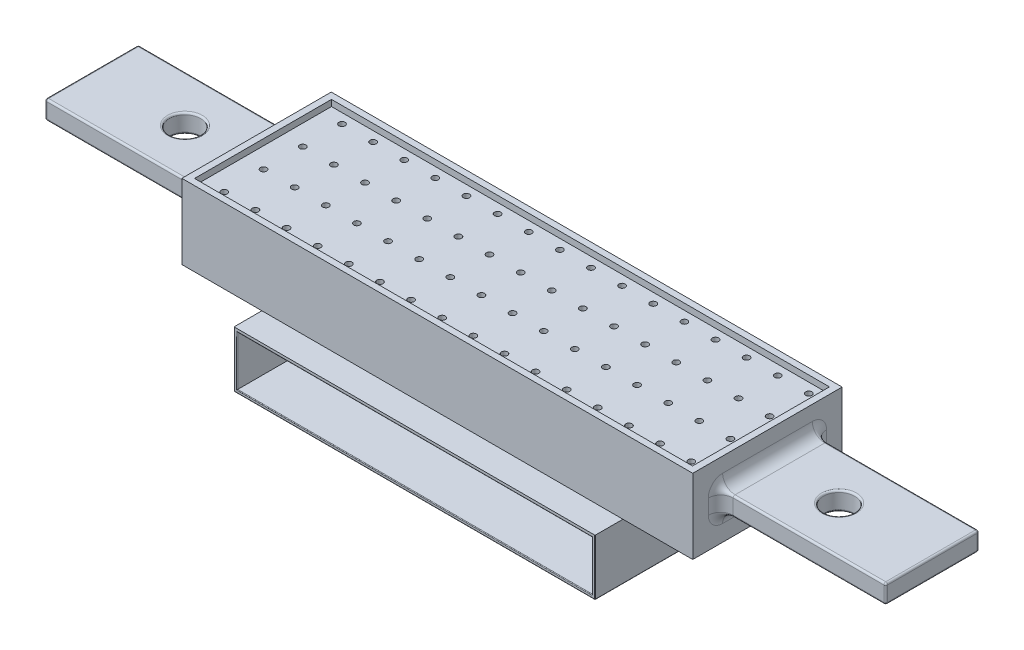
from build123d import *

# Parameters (mm, degrees)
SKETCH1_W           = 80
SKETCH1_H           = 22
SKETCH1_R           = 0.5
BOSS_EXTRUDE1_DEPTH = 10
BOSS_EXTRUDE2_START = -1
SKETCH6_W           = 82
SKETCH6_H           = 24
SKETCH6_W_2         = 80
SKETCH6_H_2         = 22
BOSS_EXTRUDE2_DEPTH = 12
SKETCH7_W           = 15
SKETCH7_H           = 3
BOSS_EXTRUDE3_DEPTH = 26.5
SKETCH8_R           = 2.5
CUT_EXTRUDE1_DEPTH  = 111.232726826
FILLET1_R           = 0.3
SKETCH10_W          = 58
SKETCH10_H          = 32
BOSS_EXTRUDE4_DEPTH = 9
SHELL1_START        = 0.5
SHELL1_OUTLINE_W    = 81.075214662
SHELL1_OUTLINE_H    = 23
SHELL1_OUTLINE_R    = 1
SHELL1_DEPTH        = 9
SHELL1_START_2      = -9.5
SHELL1_2_OUTLINE_W  = 57
SHELL1_2_OUTLINE_H  = 31.5
SHELL1_2_DEPTH      = 8
SHELL1_START_3      = 4.110326736
SHELL1_3_OUTLINE_W  = 26.5
SHELL1_3_OUTLINE_H  = 14
SHELL1_3_OUTLINE_R  = 3
SHELL1_3_DEPTH      = 2
SHELL1_START_4      = -0.5
SHELL1_4_OUTLINE_W  = 0.037607331
SHELL1_4_OUTLINE_H  = 23
SHELL1_4_DEPTH      = 11
FILLET2_R           = 0.1
FILLET3_R           = 2


# Read off the part's stored shape, not the designer's step: Shell1
with BuildPart() as part:
    # Sketch1 → Boss-Extrude1 (new body)
    with BuildSketch(Plane(origin=(0, 0, 0), x_dir=(1, 0, 0), z_dir=(0, 1, 0))):
        with Locations((40, 11)):
            Rectangle(SKETCH1_W, SKETCH1_H)
        with Locations(Location((78.276716264, 1.510550974, 0), (0, 0, 270))):
            Circle(SKETCH1_R, mode=Mode.SUBTRACT)
        with Locations(Location((73.276716264, 1.510550974, 0), (0, 0, 270))):
            Circle(SKETCH1_R, mode=Mode.SUBTRACT)
        with Locations(Location((68.276716264, 1.510550974, 0), (0, 0, 270))):
            Circle(SKETCH1_R, mode=Mode.SUBTRACT)
        with Locations(Location((63.276716264, 1.510550974, 0), (0, 0, 270))):
            Circle(SKETCH1_R, mode=Mode.SUBTRACT)
        with Locations(Location((58.276716264, 1.510550974, 0), (0, 0, 270))):
            Circle(SKETCH1_R, mode=Mode.SUBTRACT)
        with Locations(Location((53.276716264, 1.510550974, 0), (0, 0, 270))):
            Circle(SKETCH1_R, mode=Mode.SUBTRACT)
        with Locations(Location((48.276716264, 1.510550974, 0), (0, 0, 270))):
            Circle(SKETCH1_R, mode=Mode.SUBTRACT)
        with Locations(Location((43.276716264, 1.510550974, 0), (0, 0, 270))):
            Circle(SKETCH1_R, mode=Mode.SUBTRACT)
        with Locations(Location((38.276716264, 1.510550974, 0), (0, 0, 270))):
            Circle(SKETCH1_R, mode=Mode.SUBTRACT)
        with Locations(Location((33.276716264, 1.510550974, 0), (0, 0, 270))):
            Circle(SKETCH1_R, mode=Mode.SUBTRACT)
        with Locations(Location((28.276716264, 1.510550974, 0), (0, 0, 270))):
            Circle(SKETCH1_R, mode=Mode.SUBTRACT)
        with Locations(Location((23.276716264, 1.510550974, 0), (0, 0, 270))):
            Circle(SKETCH1_R, mode=Mode.SUBTRACT)
        with Locations(Location((18.276716264, 1.510550974, 0), (0, 0, 270))):
            Circle(SKETCH1_R, mode=Mode.SUBTRACT)
        with Locations(Location((13.276716264, 1.510550974, 0), (0, 0, 270))):
            Circle(SKETCH1_R, mode=Mode.SUBTRACT)
        with Locations(Location((8.276716264, 1.510550974, 0), (0, 0, 270))):
            Circle(SKETCH1_R, mode=Mode.SUBTRACT)
        with Locations(Location((3.276716264, 1.510550974, 0), (0, 0, 270))):
            Circle(SKETCH1_R, mode=Mode.SUBTRACT)
        with Locations(Location((73.276716264, 7.810550974, 0), (0, 0, 270))):
            Circle(SKETCH1_R, mode=Mode.SUBTRACT)
        with Locations(Location((68.276716264, 7.810550974, 0), (0, 0, 270))):
            Circle(SKETCH1_R, mode=Mode.SUBTRACT)
        with Locations(Location((63.276716264, 7.810550974, 0), (0, 0, 270))):
            Circle(SKETCH1_R, mode=Mode.SUBTRACT)
        with Locations(Location((58.276716264, 7.810550974, 0), (0, 0, 270))):
            Circle(SKETCH1_R, mode=Mode.SUBTRACT)
        with Locations(Location((53.276716264, 7.810550974, 0), (0, 0, 270))):
            Circle(SKETCH1_R, mode=Mode.SUBTRACT)
        with Locations(Location((48.276716264, 7.810550974, 0), (0, 0, 270))):
            Circle(SKETCH1_R, mode=Mode.SUBTRACT)
        with Locations(Location((43.276716264, 7.810550974, 0), (0, 0, 270))):
            Circle(SKETCH1_R, mode=Mode.SUBTRACT)
        with Locations(Location((38.276716264, 7.810550974, 0), (0, 0, 270))):
            Circle(SKETCH1_R, mode=Mode.SUBTRACT)
        with Locations(Location((33.276716264, 7.810550974, 0), (0, 0, 270))):
            Circle(SKETCH1_R, mode=Mode.SUBTRACT)
        with Locations(Location((28.276716264, 7.810550974, 0), (0, 0, 270))):
            Circle(SKETCH1_R, mode=Mode.SUBTRACT)
        with Locations(Location((23.276716264, 7.810550974, 0), (0, 0, 270))):
            Circle(SKETCH1_R, mode=Mode.SUBTRACT)
        with Locations(Location((18.276716264, 7.810550974, 0), (0, 0, 270))):
            Circle(SKETCH1_R, mode=Mode.SUBTRACT)
        with Locations(Location((13.276716264, 7.810550974, 0), (0, 0, 270))):
            Circle(SKETCH1_R, mode=Mode.SUBTRACT)
        with Locations(Location((8.276716264, 7.810550974, 0), (0, 0, 270))):
            Circle(SKETCH1_R, mode=Mode.SUBTRACT)
        with Locations(Location((3.276716264, 7.810550974, 0), (0, 0, 270))):
            Circle(SKETCH1_R, mode=Mode.SUBTRACT)
        with Locations(Location((73.276716264, 14.110550974, 0), (0, 0, 270))):
            Circle(SKETCH1_R, mode=Mode.SUBTRACT)
        with Locations(Location((68.276716264, 14.110550974, 0), (0, 0, 270))):
            Circle(SKETCH1_R, mode=Mode.SUBTRACT)
        with Locations(Location((63.276716264, 14.110550974, 0), (0, 0, 270))):
            Circle(SKETCH1_R, mode=Mode.SUBTRACT)
        with Locations(Location((58.276716264, 14.110550974, 0), (0, 0, 270))):
            Circle(SKETCH1_R, mode=Mode.SUBTRACT)
        with Locations(Location((53.276716264, 14.110550974, 0), (0, 0, 270))):
            Circle(SKETCH1_R, mode=Mode.SUBTRACT)
        with Locations(Location((48.276716264, 14.110550974, 0), (0, 0, 270))):
            Circle(SKETCH1_R, mode=Mode.SUBTRACT)
        with Locations(Location((43.276716264, 14.110550974, 0), (0, 0, 270))):
            Circle(SKETCH1_R, mode=Mode.SUBTRACT)
        with Locations(Location((38.276716264, 14.110550974, 0), (0, 0, 270))):
            Circle(SKETCH1_R, mode=Mode.SUBTRACT)
        with Locations(Location((33.276716264, 14.110550974, 0), (0, 0, 270))):
            Circle(SKETCH1_R, mode=Mode.SUBTRACT)
        with Locations(Location((28.276716264, 14.110550974, 0), (0, 0, 270))):
            Circle(SKETCH1_R, mode=Mode.SUBTRACT)
        with Locations(Location((23.276716264, 14.110550974, 0), (0, 0, 270))):
            Circle(SKETCH1_R, mode=Mode.SUBTRACT)
        with Locations(Location((18.276716264, 14.110550974, 0), (0, 0, 270))):
            Circle(SKETCH1_R, mode=Mode.SUBTRACT)
        with Locations(Location((13.276716264, 14.110550974, 0), (0, 0, 270))):
            Circle(SKETCH1_R, mode=Mode.SUBTRACT)
        with Locations(Location((8.276716264, 14.110550974, 0), (0, 0, 270))):
            Circle(SKETCH1_R, mode=Mode.SUBTRACT)
        with Locations(Location((3.276716264, 14.110550974, 0), (0, 0, 270))):
            Circle(SKETCH1_R, mode=Mode.SUBTRACT)
        with Locations(Location((73.276716264, 20.410550974, 0), (0, 0, 270))):
            Circle(SKETCH1_R, mode=Mode.SUBTRACT)
        with Locations(Location((68.276716264, 20.410550974, 0), (0, 0, 270))):
            Circle(SKETCH1_R, mode=Mode.SUBTRACT)
        with Locations(Location((63.276716264, 20.410550974, 0), (0, 0, 270))):
            Circle(SKETCH1_R, mode=Mode.SUBTRACT)
        with Locations(Location((58.276716264, 20.410550974, 0), (0, 0, 270))):
            Circle(SKETCH1_R, mode=Mode.SUBTRACT)
        with Locations(Location((53.276716264, 20.410550974, 0), (0, 0, 270))):
            Circle(SKETCH1_R, mode=Mode.SUBTRACT)
        with Locations(Location((48.276716264, 20.410550974, 0), (0, 0, 270))):
            Circle(SKETCH1_R, mode=Mode.SUBTRACT)
        with Locations(Location((43.276716264, 20.410550974, 0), (0, 0, 270))):
            Circle(SKETCH1_R, mode=Mode.SUBTRACT)
        with Locations(Location((38.276716264, 20.410550974, 0), (0, 0, 270))):
            Circle(SKETCH1_R, mode=Mode.SUBTRACT)
        with Locations(Location((33.276716264, 20.410550974, 0), (0, 0, 270))):
            Circle(SKETCH1_R, mode=Mode.SUBTRACT)
        with Locations(Location((28.276716264, 20.410550974, 0), (0, 0, 270))):
            Circle(SKETCH1_R, mode=Mode.SUBTRACT)
        with Locations(Location((23.276716264, 20.410550974, 0), (0, 0, 270))):
            Circle(SKETCH1_R, mode=Mode.SUBTRACT)
        with Locations(Location((18.276716264, 20.410550974, 0), (0, 0, 270))):
            Circle(SKETCH1_R, mode=Mode.SUBTRACT)
        with Locations(Location((13.276716264, 20.410550974, 0), (0, 0, 270))):
            Circle(SKETCH1_R, mode=Mode.SUBTRACT)
        with Locations(Location((8.276716264, 20.410550974, 0), (0, 0, 270))):
            Circle(SKETCH1_R, mode=Mode.SUBTRACT)
        with Locations(Location((3.276716264, 20.410550974, 0), (0, 0, 270))):
            Circle(SKETCH1_R, mode=Mode.SUBTRACT)
        with Locations(Location((78.276716264, 7.810550974, 0), (0, 0, 270))):
            Circle(SKETCH1_R, mode=Mode.SUBTRACT)
        with Locations(Location((78.276716264, 14.110550974, 0), (0, 0, 270))):
            Circle(SKETCH1_R, mode=Mode.SUBTRACT)
        with Locations(Location((78.276716264, 20.410550974, 0), (0, 0, 270))):
            Circle(SKETCH1_R, mode=Mode.SUBTRACT)
    extrude(amount=BOSS_EXTRUDE1_DEPTH)

    # Sketch6 → Boss-Extrude2 (add)
    with BuildSketch(Plane(origin=(0, 0, 0), x_dir=(1, 0, 0), z_dir=(0, 1, 0)).offset(BOSS_EXTRUDE2_START)):
        with Locations((39.962392669, 11)):
            Rectangle(SKETCH6_W, SKETCH6_H)
        with Locations((40, 11)):
            Rectangle(SKETCH6_W_2, SKETCH6_H_2, mode=Mode.SUBTRACT)
    boss_extrude2 = extrude(amount=BOSS_EXTRUDE2_DEPTH)

    # Sketch7 → Boss-Extrude3 (add)
    with BuildSketch(Plane.ZY.offset(1.037607331)):
        with Locations((-11, 5.110326736)):
            Rectangle(SKETCH7_W, SKETCH7_H)
    boss_extrude3 = extrude(amount=BOSS_EXTRUDE3_DEPTH)

    # Mirror2: Boss-Extrude2, Boss-Extrude3 across plane
    add(boss_extrude2.mirror(Plane(origin=(40, 0, 0), x_dir=(0, 0, 1), z_dir=(1, 0, 0))))
    add(boss_extrude3.mirror(Plane(origin=(40, 0, 0), x_dir=(0, 0, 1), z_dir=(1, 0, 0))))

    # Sketch8 → Cut-Extrude1 (cut, through all)
    with BuildSketch(Plane(origin=(0, 6.610326736, 0), x_dir=(1, 0, 0), z_dir=(0, 1, 0))):
        with Locations(Location((-12.537607331, 11, 0), (0, 0, 270))):
            Circle(SKETCH8_R)
    cut_extrude1 = extrude(amount=-CUT_EXTRUDE1_DEPTH, mode=Mode.SUBTRACT)

    # Mirror3: Cut-Extrude1 across plane
    add(cut_extrude1.mirror(Plane(origin=(40, 0, 0), x_dir=(0, 0, 1), z_dir=(1, 0, 0))), mode=Mode.SUBTRACT)

    # Fillet1
    fillet1_edges = [part.edges().sort_by_distance(p)[0] for p in [
        (-14.287607331, 3.610326736, -3.5),
        (-14.287607331, 6.610326736, -3.5),
        (-14.287607331, 6.610326736, -18.5),
        (-14.287607331, 3.610326736, -18.5),
        (-27.537607331, 5.110326736, -3.5),
        (-27.537607331, 6.610326736, -11),
        (-27.537607331, 5.110326736, -18.5),
        (-27.537607331, 3.610326736, -11),
        (107.537607331, 5.110326736, -3.5),
        (94.287607331, 6.610326736, -3.5),
        (107.537607331, 3.610326736, -11),
        (94.287607331, 3.610326736, -3.5),
        (107.537607331, 5.110326736, -18.5),
        (94.287607331, 3.610326736, -18.5),
        (107.537607331, 6.610326736, -11),
        (94.287607331, 6.610326736, -18.5),
        (-12.537607331, 3.610326736, -13.5),
        (-12.537607331, 6.610326736, -13.5),
        (92.537607331, 3.610326736, -13.5),
        (92.537607331, 6.610326736, -13.5),
    ]]
    fillet(fillet1_edges, radius=FILLET1_R)

    # Sketch10 → Boss-Extrude4 (add)
    with BuildSketch(Plane(origin=(0, -1, 0), x_dir=(1, 0, 0), z_dir=(0, 1, 0))):
        with Locations((40.819120301, 10.527322686)):
            Rectangle(SKETCH10_W, SKETCH10_H)
    extrude(amount=-BOSS_EXTRUDE4_DEPTH)

    # Shell1 outline → Shell1 (cut)
    with BuildSketch(Plane(origin=(0, 0, 0), x_dir=(1, 0, 0), z_dir=(0, 1, 0)).offset(SHELL1_START)):
        with Locations((40, 11)):
            Rectangle(SHELL1_OUTLINE_W, SHELL1_OUTLINE_H)
        with Locations((13.276716264, 1.510550974)):
            Circle(SHELL1_OUTLINE_R, mode=Mode.SUBTRACT)
        with Locations((13.276716264, 7.810550974)):
            Circle(SHELL1_OUTLINE_R, mode=Mode.SUBTRACT)
        with Locations((13.276716264, 14.110550974)):
            Circle(SHELL1_OUTLINE_R, mode=Mode.SUBTRACT)
        with Locations((13.276716264, 20.410550974)):
            Circle(SHELL1_OUTLINE_R, mode=Mode.SUBTRACT)
        with Locations((18.276716264, 1.510550974)):
            Circle(SHELL1_OUTLINE_R, mode=Mode.SUBTRACT)
        with Locations((23.276716264, 1.510550974)):
            Circle(SHELL1_OUTLINE_R, mode=Mode.SUBTRACT)
        with Locations((28.276716264, 1.510550974)):
            Circle(SHELL1_OUTLINE_R, mode=Mode.SUBTRACT)
        with Locations((33.276716264, 1.510550974)):
            Circle(SHELL1_OUTLINE_R, mode=Mode.SUBTRACT)
        with Locations((38.276716264, 1.510550974)):
            Circle(SHELL1_OUTLINE_R, mode=Mode.SUBTRACT)
        with Locations((18.276716264, 7.810550974)):
            Circle(SHELL1_OUTLINE_R, mode=Mode.SUBTRACT)
        with Locations((23.276716264, 7.810550974)):
            Circle(SHELL1_OUTLINE_R, mode=Mode.SUBTRACT)
        with Locations((28.276716264, 7.810550974)):
            Circle(SHELL1_OUTLINE_R, mode=Mode.SUBTRACT)
        with Locations((33.276716264, 7.810550974)):
            Circle(SHELL1_OUTLINE_R, mode=Mode.SUBTRACT)
        with Locations((38.276716264, 7.810550974)):
            Circle(SHELL1_OUTLINE_R, mode=Mode.SUBTRACT)
        with Locations((43.276716264, 1.510550974)):
            Circle(SHELL1_OUTLINE_R, mode=Mode.SUBTRACT)
        with Locations((48.276716264, 1.510550974)):
            Circle(SHELL1_OUTLINE_R, mode=Mode.SUBTRACT)
        with Locations((53.276716264, 1.510550974)):
            Circle(SHELL1_OUTLINE_R, mode=Mode.SUBTRACT)
        with Locations((58.276716264, 1.510550974)):
            Circle(SHELL1_OUTLINE_R, mode=Mode.SUBTRACT)
        with Locations((63.276716264, 1.510550974)):
            Circle(SHELL1_OUTLINE_R, mode=Mode.SUBTRACT)
        with Locations((68.276716264, 1.510550974)):
            Circle(SHELL1_OUTLINE_R, mode=Mode.SUBTRACT)
        with Locations((43.276716264, 7.810550974)):
            Circle(SHELL1_OUTLINE_R, mode=Mode.SUBTRACT)
        with Locations((48.276716264, 7.810550974)):
            Circle(SHELL1_OUTLINE_R, mode=Mode.SUBTRACT)
        with Locations((53.276716264, 7.810550974)):
            Circle(SHELL1_OUTLINE_R, mode=Mode.SUBTRACT)
        with Locations((58.276716264, 7.810550974)):
            Circle(SHELL1_OUTLINE_R, mode=Mode.SUBTRACT)
        with Locations((63.276716264, 7.810550974)):
            Circle(SHELL1_OUTLINE_R, mode=Mode.SUBTRACT)
        with Locations((68.276716264, 7.810550974)):
            Circle(SHELL1_OUTLINE_R, mode=Mode.SUBTRACT)
        with Locations((18.276716264, 14.110550974)):
            Circle(SHELL1_OUTLINE_R, mode=Mode.SUBTRACT)
        with Locations((23.276716264, 14.110550974)):
            Circle(SHELL1_OUTLINE_R, mode=Mode.SUBTRACT)
        with Locations((28.276716264, 14.110550974)):
            Circle(SHELL1_OUTLINE_R, mode=Mode.SUBTRACT)
        with Locations((33.276716264, 14.110550974)):
            Circle(SHELL1_OUTLINE_R, mode=Mode.SUBTRACT)
        with Locations((38.276716264, 14.110550974)):
            Circle(SHELL1_OUTLINE_R, mode=Mode.SUBTRACT)
        with Locations((18.276716264, 20.410550974)):
            Circle(SHELL1_OUTLINE_R, mode=Mode.SUBTRACT)
        with Locations((23.276716264, 20.410550974)):
            Circle(SHELL1_OUTLINE_R, mode=Mode.SUBTRACT)
        with Locations((28.276716264, 20.410550974)):
            Circle(SHELL1_OUTLINE_R, mode=Mode.SUBTRACT)
        with Locations((33.276716264, 20.410550974)):
            Circle(SHELL1_OUTLINE_R, mode=Mode.SUBTRACT)
        with Locations((38.276716264, 20.410550974)):
            Circle(SHELL1_OUTLINE_R, mode=Mode.SUBTRACT)
        with Locations((43.276716264, 14.110550974)):
            Circle(SHELL1_OUTLINE_R, mode=Mode.SUBTRACT)
        with Locations((48.276716264, 14.110550974)):
            Circle(SHELL1_OUTLINE_R, mode=Mode.SUBTRACT)
        with Locations((53.276716264, 14.110550974)):
            Circle(SHELL1_OUTLINE_R, mode=Mode.SUBTRACT)
        with Locations((58.276716264, 14.110550974)):
            Circle(SHELL1_OUTLINE_R, mode=Mode.SUBTRACT)
        with Locations((63.276716264, 14.110550974)):
            Circle(SHELL1_OUTLINE_R, mode=Mode.SUBTRACT)
        with Locations((68.276716264, 14.110550974)):
            Circle(SHELL1_OUTLINE_R, mode=Mode.SUBTRACT)
        with Locations((43.276716264, 20.410550974)):
            Circle(SHELL1_OUTLINE_R, mode=Mode.SUBTRACT)
        with Locations((48.276716264, 20.410550974)):
            Circle(SHELL1_OUTLINE_R, mode=Mode.SUBTRACT)
        with Locations((53.276716264, 20.410550974)):
            Circle(SHELL1_OUTLINE_R, mode=Mode.SUBTRACT)
        with Locations((58.276716264, 20.410550974)):
            Circle(SHELL1_OUTLINE_R, mode=Mode.SUBTRACT)
        with Locations((63.276716264, 20.410550974)):
            Circle(SHELL1_OUTLINE_R, mode=Mode.SUBTRACT)
        with Locations((68.276716264, 20.410550974)):
            Circle(SHELL1_OUTLINE_R, mode=Mode.SUBTRACT)
        with Locations((78.276716264, 20.410550974)):
            Circle(SHELL1_OUTLINE_R, mode=Mode.SUBTRACT)
        with Locations((73.276716264, 1.510550974)):
            Circle(SHELL1_OUTLINE_R, mode=Mode.SUBTRACT)
        with Locations((78.276716264, 1.510550974)):
            Circle(SHELL1_OUTLINE_R, mode=Mode.SUBTRACT)
        with Locations((73.276716264, 7.810550974)):
            Circle(SHELL1_OUTLINE_R, mode=Mode.SUBTRACT)
        with Locations((78.276716264, 7.810550974)):
            Circle(SHELL1_OUTLINE_R, mode=Mode.SUBTRACT)
        with Locations((73.276716264, 14.110550974)):
            Circle(SHELL1_OUTLINE_R, mode=Mode.SUBTRACT)
        with Locations((78.276716264, 14.110550974)):
            Circle(SHELL1_OUTLINE_R, mode=Mode.SUBTRACT)
        with Locations((73.276716264, 20.410550974)):
            Circle(SHELL1_OUTLINE_R, mode=Mode.SUBTRACT)
        with Locations((8.276716264, 7.810550974)):
            Circle(SHELL1_OUTLINE_R, mode=Mode.SUBTRACT)
        with Locations((3.276716264, 14.110550974)):
            Circle(SHELL1_OUTLINE_R, mode=Mode.SUBTRACT)
        with Locations((8.276716264, 14.110550974)):
            Circle(SHELL1_OUTLINE_R, mode=Mode.SUBTRACT)
        with Locations((3.276716264, 20.410550974)):
            Circle(SHELL1_OUTLINE_R, mode=Mode.SUBTRACT)
        with Locations((8.276716264, 20.410550974)):
            Circle(SHELL1_OUTLINE_R, mode=Mode.SUBTRACT)
        with Locations((3.276716264, 1.510550974)):
            Circle(SHELL1_OUTLINE_R, mode=Mode.SUBTRACT)
        with Locations((8.276716264, 1.510550974)):
            Circle(SHELL1_OUTLINE_R, mode=Mode.SUBTRACT)
        with Locations((3.276716264, 7.810550974)):
            Circle(SHELL1_OUTLINE_R, mode=Mode.SUBTRACT)
    extrude(amount=SHELL1_DEPTH, mode=Mode.SUBTRACT)

    # Shell1 2 outline → Shell1 2 (cut)
    with BuildSketch(Plane(origin=(0, 0, 0), x_dir=(1, 0, 0), z_dir=(0, 1, 0)).offset(SHELL1_START_2)):
        with Locations((40.819120301, 10.277322686)):
            Rectangle(SHELL1_2_OUTLINE_W, SHELL1_2_OUTLINE_H)
    extrude(amount=SHELL1_2_DEPTH, mode=Mode.SUBTRACT)

    # Shell1 3 outline → Shell1 3 (cut)
    # profile 1 of 2: a face of its own
    with BuildSketch(Plane(origin=(0, 0, 0), x_dir=(1, 0, 0), z_dir=(0, 1, 0)).offset(SHELL1_START_3)):
        with Locations((-13.787607331, 11)):
            Rectangle(SHELL1_3_OUTLINE_W, SHELL1_3_OUTLINE_H)
        with Locations((-12.537607331, 11)):
            Circle(SHELL1_3_OUTLINE_R, mode=Mode.SUBTRACT)
    # profile 2 of 2: a face of its own
    with BuildSketch(Plane(origin=(0, 0, 0), x_dir=(1, 0, 0), z_dir=(0, 1, 0)).offset(SHELL1_START_3)):
        with Locations((93.787607331, 11)):
            Rectangle(SHELL1_3_OUTLINE_W, SHELL1_3_OUTLINE_H)
        with Locations((92.537607331, 11)):
            Circle(SHELL1_3_OUTLINE_R, mode=Mode.SUBTRACT)
    extrude(amount=SHELL1_3_DEPTH, mode=Mode.SUBTRACT)

    # Shell1 4 outline → Shell1 4 (cut)
    with BuildSketch(Plane(origin=(0, 0, 0), x_dir=(1, 0, 0), z_dir=(0, 1, 0)).offset(SHELL1_START_4)):
        with Locations((-0.518803666, 11)):
            Rectangle(SHELL1_4_OUTLINE_W, SHELL1_4_OUTLINE_H)
        with Locations((80.518803666, 11)):
            Rectangle(SHELL1_4_OUTLINE_W, SHELL1_4_OUTLINE_H)
    extrude(amount=SHELL1_4_DEPTH, mode=Mode.SUBTRACT)

    # Fillet2
    fillet2_edges = [part.edges().sort_by_distance(p)[0] for p in [
        (11.819120301, -10, -10.527322686),
        (11.819120301, -5.5, 5.472677314),
        (40.819120301, -10, -26.527322686),
        (11.819120301, -5.5, -26.527322686),
        (69.819120301, -10, -10.527322686),
        (69.819120301, -5.5, -26.527322686),
        (40.819120301, -10, 5.472677314),
        (69.819120301, -5.5, 5.472677314),
        (40.819120301, -1.5, 5.472677314),
        (12.319120301, -5.5, 5.472677314),
        (40.819120301, -9.5, 5.472677314),
        (69.319120301, -5.5, 5.472677314),
    ]]
    fillet(fillet2_edges, radius=FILLET2_R)

    # Fillet3
    fillet3_edges = [part.edges().sort_by_distance(p)[0] for p in [
        (81.037607331, 6.610326736, -11),
        (81.037607331, 3.610326736, -11),
        (81.037607331, 5.110326736, -18.5),
        (81.037607331, 5.110326736, -3.5),
        (-1.037607331, 3.610326736, -11),
        (-1.037607331, 6.610326736, -11),
        (-1.037607331, 5.110326736, -18.5),
        (-1.037607331, 5.110326736, -3.5),
        (81.037607331, 3.698194702, -18.412132034),
        (81.037607331, 3.698194702, -3.587867966),
        (81.037607331, 6.522458771, -18.412132034),
        (81.037607331, 6.522458771, -3.587867966),
        (-1.037607331, 3.698194702, -18.412132034),
        (-1.037607331, 6.522458771, -18.412132034),
        (-1.037607331, 3.698194702, -3.587867966),
        (-1.037607331, 6.522458771, -3.587867966),
        (80.537607331, 6.110326736, -11),
    ]]
    fillet(fillet3_edges, radius=FILLET3_R)


solid = part.part
